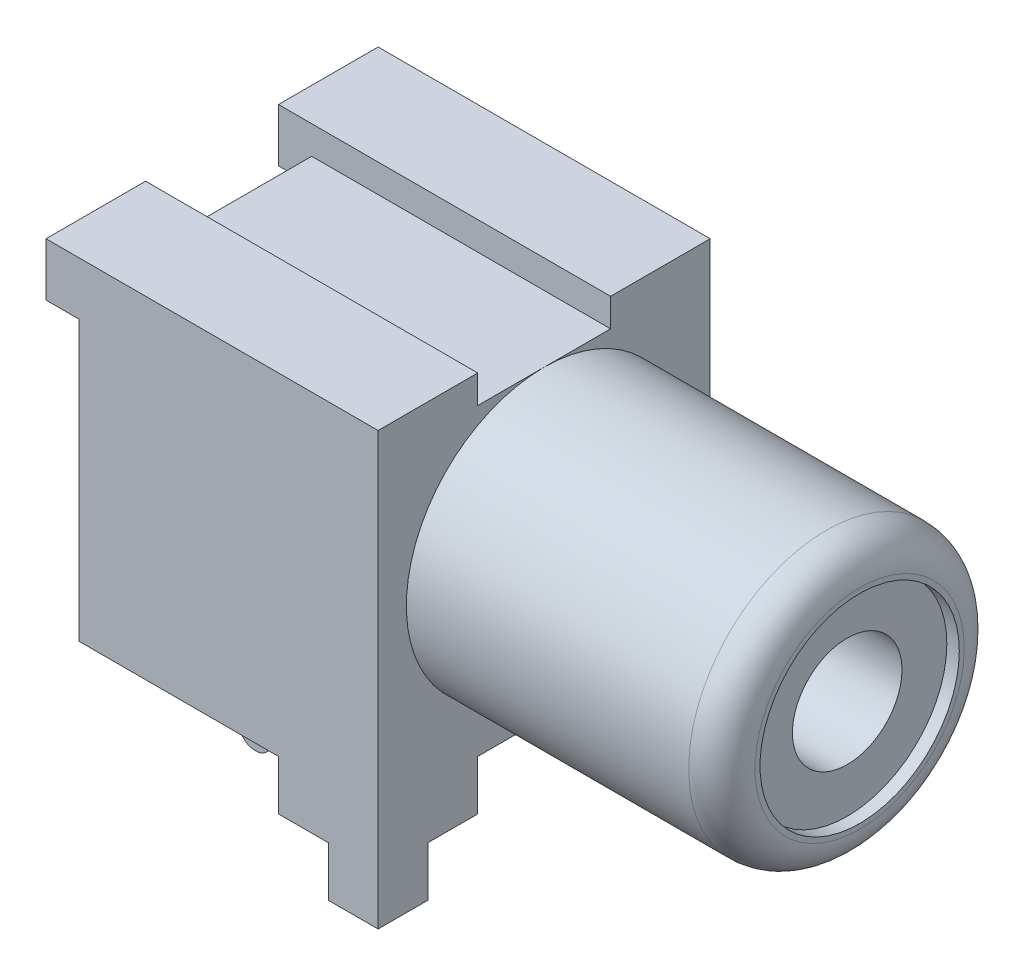
from build123d import *

# Parameters (mm, degrees)
ESBO_O1_W                                            = 10
ESBO_O1_H                                            = 11.5
RESSALTO_EXTRUS_O1_DEPTH                             = 9
ESBO_O2_W                                            = 4
ESBO_O2_H                                            = 0.85
CORTE_EXTRUS_O1_DEPTH                                = 13.175795662
ESBO_O3_W                                            = 3
ESBO_O3_H                                            = 1.6
RESSALTO_EXTRUS_O2_DEPTH                             = 1
ESBO_O4_W                                            = 3
ESBO_O4_H                                            = 1.6
RESSALTO_EXTRUS_O3_DEPTH                             = 1
ESBO_O5_W                                            = 4
ESBO_O5_H                                            = 1.5
CORTE_EXTRUS_O2_DEPTH                                = 13.932517156
ESBO_O6_W                                            = 1.5
ESBO_O6_H                                            = 1
RESSALTO_EXTRUS_O4_DEPTH                             = 1
ESBO_O7_W                                            = 1.5
ESBO_O7_H                                            = 1.5
CORTE_EXTRUS_O3_DEPTH                                = 6
ESBO_O8_W                                            = 1.5
ESBO_O8_H                                            = 1
RESSALTO_EXTRUS_O5_DEPTH                             = 1
ESBO_O9_W                                            = 1.5
ESBO_O9_H                                            = 1.5
CORTE_EXTRUS_O4_DEPTH                                = 6
ESBO_O10_W                                           = 1.5
ESBO_O10_H                                           = 1.5
RESSALTO_EXTRUS_O6_DEPTH                             = 1.5
ESBO_O11_W                                           = 1.5
ESBO_O11_H                                           = 1.5
RESSALTO_EXTRUS_O7_DEPTH                             = 1.5
ESBO_O12_W                                           = 9.5
ESBO_O12_H                                           = 4.15
REBAIXO_PARA_PARAFUSO_DE_M_QUINA_DE_CABE_D           = 3.3
REBAIXO_PARA_PARAFUSO_DE_M_QUINA_DE_CABE_DEPTH       = 9.5
REBAIXO_PARA_PARAFUSO_DE_M_QUINA_DE_CABE_CBORE_D     = 6
REBAIXO_PARA_PARAFUSO_DE_M_QUINA_DE_CABE_CBORE_DEPTH = 0.375
FILETE1_R                                            = 1
RESSALTO_EXTRUS_O9_DEPTH                             = 0.2


with BuildPart() as part:
    # Esboço1 → Ressalto-extrusão1 (new body)
    with BuildSketch(Plane(origin=(10, 0, 0), x_dir=(0, 0, -1), z_dir=(1, 0, 0))):
        with Locations((0, -0.75)):
            Rectangle(ESBO_O1_W, ESBO_O1_H)
    extrude(amount=-RESSALTO_EXTRUS_O1_DEPTH)

    # Esboço2 → Corte-extrusão1 (cut, through all)
    with BuildSketch(Plane(origin=(10, 0, 0), x_dir=(0, 0, -1), z_dir=(1, 0, 0))):
        with Locations((0, 4.575)):
            Rectangle(ESBO_O2_W, ESBO_O2_H)
    extrude(amount=-CORTE_EXTRUS_O1_DEPTH, mode=Mode.SUBTRACT)

    # Esboço3 → Ressalto-extrusão2 (add)
    with BuildSketch(Plane.ZY.offset(-1)):
        with Locations((3.5, 4.2)):
            Rectangle(ESBO_O3_W, ESBO_O3_H)
    extrude(amount=RESSALTO_EXTRUS_O2_DEPTH)

    # Esboço4 → Ressalto-extrusão3 (add)
    with BuildSketch(Plane.ZY.offset(-1)):
        with Locations((-3.5, 4.2)):
            Rectangle(ESBO_O4_W, ESBO_O4_H)
    extrude(amount=RESSALTO_EXTRUS_O3_DEPTH)

    # Esboço5 → Corte-extrusão2 (cut, through all)
    with BuildSketch(Plane(origin=(10, 0, 0), x_dir=(0, 0, -1), z_dir=(1, 0, 0))):
        with Locations((0, -5.75)):
            Rectangle(ESBO_O5_W, ESBO_O5_H)
    extrude(amount=-CORTE_EXTRUS_O2_DEPTH, mode=Mode.SUBTRACT)

    # Esboço6 → Ressalto-extrusão4 (add)
    with BuildSketch(Plane.ZY.offset(-1)):
        with Locations((2.75, -6)):
            Rectangle(ESBO_O6_W, ESBO_O6_H)
    extrude(amount=RESSALTO_EXTRUS_O4_DEPTH)

    # Esboço7 → Corte-extrusão3 (cut)
    with BuildSketch(Plane.ZY.offset(-1)):
        with Locations((4.25, -5.75)):
            Rectangle(ESBO_O7_W, ESBO_O7_H)
    extrude(amount=-CORTE_EXTRUS_O3_DEPTH, mode=Mode.SUBTRACT)

    # Esboço8 → Ressalto-extrusão5 (add)
    with BuildSketch(Plane.ZY.offset(-1)):
        with Locations((-2.75, -6)):
            Rectangle(ESBO_O8_W, ESBO_O8_H)
    extrude(amount=RESSALTO_EXTRUS_O5_DEPTH)

    # Esboço9 → Corte-extrusão4 (cut)
    with BuildSketch(Plane.ZY.offset(-1)):
        with Locations((-4.25, -5.75)):
            Rectangle(ESBO_O9_W, ESBO_O9_H)
    extrude(amount=-CORTE_EXTRUS_O4_DEPTH, mode=Mode.SUBTRACT)

    # Esboço10 → Ressalto-extrusão6 (add)
    with BuildSketch(Plane.XZ.offset(6.5)):
        with Locations((9.25, 4.25)):
            Rectangle(ESBO_O10_W, ESBO_O10_H)
    extrude(amount=RESSALTO_EXTRUS_O6_DEPTH)

    # Esboço11 → Ressalto-extrusão7 (add)
    with BuildSketch(Plane.XZ.offset(6.5)):
        with Locations((9.25, -4.25)):
            Rectangle(ESBO_O11_W, ESBO_O11_H)
    extrude(amount=RESSALTO_EXTRUS_O7_DEPTH)

    # Esboço12 → Revolução1 (revolve)
    with BuildSketch(Plane.XY):
        with Locations((14.75, 2.075)):
            Rectangle(ESBO_O12_W, ESBO_O12_H)
    revolve(axis=Axis((10, 0, 0), (1, 0, 0)))

    # Rebaixo para parafuso de máquina de cabeça sextavada de M31
    with Locations(Plane(origin=(19.5, 0, 0), x_dir=(0, 0, -1), z_dir=(1, 0, 0))):
        with Locations((0, 0)):
            CounterBoreHole(REBAIXO_PARA_PARAFUSO_DE_M_QUINA_DE_CABE_D / 2, REBAIXO_PARA_PARAFUSO_DE_M_QUINA_DE_CABE_CBORE_D / 2, REBAIXO_PARA_PARAFUSO_DE_M_QUINA_DE_CABE_CBORE_DEPTH, depth=REBAIXO_PARA_PARAFUSO_DE_M_QUINA_DE_CABE_DEPTH)

    # Filete1
    filete1_edges = [part.edges().sort_by_distance(p)[0] for p in [
        (19.5, -4.15, 0),
    ]]
    fillet(filete1_edges, radius=FILETE1_R)

    # Esboço16 → Ressalto-extrusão9 (add, symmetric)
    with BuildSketch(Plane(origin=(0, 0, 0), x_dir=(-1, 0, 0), z_dir=(0, 0, -1))):
        with BuildLine():
            Line((-2, -5), (-2, -9.5))
            ThreePointArc((-2, -9.5), (-1.569549144, -9.99513929), (-1.019348334, -9.637746055))
            Line((-1.019348334, -9.637746055), (-0.549999999, -8))
            Line((-0.549999999, -8), (-0.8, -7.928354531))
            Line((-0.8, -7.928354531), (-0.8, 3.5))
            Line((-0.8, 3.5), (-1, 3.5))
            Line((-1, 3.5), (-2, -5))
        make_face()
    extrude(amount=RESSALTO_EXTRUS_O9_DEPTH, both=True)


solid = part.part
